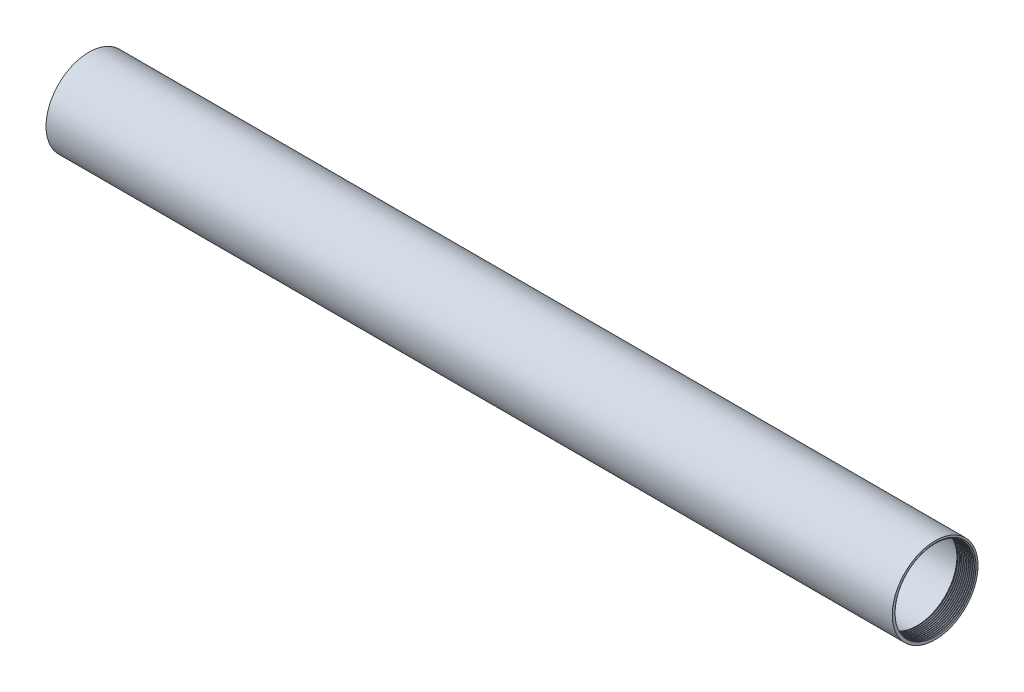
from build123d import *

# Parameters (mm, degrees)
THREAD1_PITCH = 1.5875
THREAD1_FROM  = 1.5875
THREAD2_PITCH = 1.5875
THREAD2_FROM  = 1.5875


with BuildPart() as part:
    # Sketch1 → Revolve1 (revolve)
    with BuildSketch(Plane.XY, mode=Mode.PRIVATE) as revolve1_sk:
        Polygon((0, 37.719), (743.966, 37.719), (743.966, 35.2425), (728.091, 35.2425), (728.091, 34.925), (15.875, 34.925), (15.875, 35.2425), (0, 35.2425), align=None)
    revolve(revolve1_sk.sketch.rotate(Axis((0, 0, 0), (1, 0, 0)), 90), axis=Axis((0, 0, 0), (1, 0, 0)))

    # Thread1: arcs per turn and ends read off the stored shape
    # Thread1: the profile of Thread Profile1 profile screwed along a right-hand helix through 11 turns, 8 arcs to a turn; built about Z, then put on its axis
    thread1_z = Axis((0, 0, 0), (0, 0, 1))
    thread1_corners = [(35.2422, 0, -0.000173205), (36.101759577, 0, 0.496093748), (36.101759577, 0, 0.694531248), (35.2422, 0, 1.190798201)]
    with BuildLine(mode=Mode.PRIVATE) as thread1_profile:
        Line(thread1_corners[0], thread1_corners[1])
        Line(thread1_corners[1], thread1_corners[2])
        Line(thread1_corners[2], thread1_corners[3])
        Line(thread1_corners[3], thread1_corners[0])
    thread1_cap = Face(thread1_profile.wire())
    thread1_turn_angles = [0, 22.5, 45, 67.5, 90, 112.5, 135, 157.5, 180, 202.5, 225, 247.5, 270, 292.5, 315, 337.5, 360]
    thread1_turn_weights = [1, 0.9238795325112867, 1, 0.9238795325112867, 1, 0.9238795325112867, 1, 0.9238795325112867, 1, 0.9238795325112867, 1, 0.9238795325112867, 1, 0.9238795325112867, 1, 0.9238795325112867, 1]
    thread1_turn_rails = [Edge.make_bspline([Vector(p[0], p[1], 0).rotate(thread1_z, thread1_turn_angles[k]) / thread1_turn_weights[k] + Vector(0, 0, p[2] + THREAD1_PITCH * thread1_turn_angles[k] / 360) for k in range(17)], [0, 0, 0, 1, 1, 2, 2, 3, 3, 4, 4, 5, 5, 6, 6, 7, 7, 8, 8, 8], 2, thread1_turn_weights) for p in thread1_corners]
    thread1_turn_sides = [Face.make_surface_from_curves(thread1_turn_rails[p[0]], thread1_turn_rails[p[1]]) for p in [(0, 1), (1, 2), (2, 3), (3, 0)]]
    thread1 = Plane(origin=(17.4625, 0, 0), x_dir=(0, 0, 1), z_dir=(-1, 0, 0)) * split(Solid(Shell([*[p.moved(Location((0, 0, THREAD1_PITCH * i))) for i in range(11) for p in thread1_turn_sides], thread1_cap, thread1_cap.rotate(thread1_z, 3960).moved(Location((0, 0, THREAD1_PITCH * 3960 / 360)))])), bisect_by=Plane.XY.offset(THREAD1_FROM), keep=Keep.TOP, mode=Mode.PRIVATE)
    add(thread1, mode=Mode.SUBTRACT)

    # Thread2: arcs per turn and ends read off the stored shape
    # Thread2: the profile of Thread Profile2 profile screwed along a right-hand helix through 11 turns, 8 arcs to a turn; built about Z, then put on its axis
    thread2_z = Axis((0, 0, 0), (0, 0, 1))
    thread2_corners = [(35.2422, 0, -0.000173205), (36.101759577, 0, 0.496093748), (36.101759577, 0, 0.694531248), (35.2422, 0, 1.190798201)]
    with BuildLine(mode=Mode.PRIVATE) as thread2_profile:
        Line(thread2_corners[0], thread2_corners[1])
        Line(thread2_corners[1], thread2_corners[2])
        Line(thread2_corners[2], thread2_corners[3])
        Line(thread2_corners[3], thread2_corners[0])
    thread2_cap = Face(thread2_profile.wire())
    thread2_turn_angles = [0, 22.5, 45, 67.5, 90, 112.5, 135, 157.5, 180, 202.5, 225, 247.5, 270, 292.5, 315, 337.5, 360]
    thread2_turn_weights = [1, 0.9238795325112867, 1, 0.9238795325112867, 1, 0.9238795325112867, 1, 0.9238795325112867, 1, 0.9238795325112867, 1, 0.9238795325112867, 1, 0.9238795325112867, 1, 0.9238795325112867, 1]
    thread2_turn_rails = [Edge.make_bspline([Vector(p[0], p[1], 0).rotate(thread2_z, thread2_turn_angles[k]) / thread2_turn_weights[k] + Vector(0, 0, p[2] + THREAD2_PITCH * thread2_turn_angles[k] / 360) for k in range(17)], [0, 0, 0, 1, 1, 2, 2, 3, 3, 4, 4, 5, 5, 6, 6, 7, 7, 8, 8, 8], 2, thread2_turn_weights) for p in thread2_corners]
    thread2_turn_sides = [Face.make_surface_from_curves(thread2_turn_rails[p[0]], thread2_turn_rails[p[1]]) for p in [(0, 1), (1, 2), (2, 3), (3, 0)]]
    thread2 = Plane(origin=(726.5035, 0, 0), x_dir=(0, 0, 1), z_dir=(1, 0, 0)) * split(Solid(Shell([*[p.moved(Location((0, 0, THREAD2_PITCH * i))) for i in range(11) for p in thread2_turn_sides], thread2_cap, thread2_cap.rotate(thread2_z, 3960).moved(Location((0, 0, THREAD2_PITCH * 3960 / 360)))])), bisect_by=Plane.XY.offset(THREAD2_FROM), keep=Keep.TOP, mode=Mode.PRIVATE)
    add(thread2, mode=Mode.SUBTRACT)


solid = part.part
